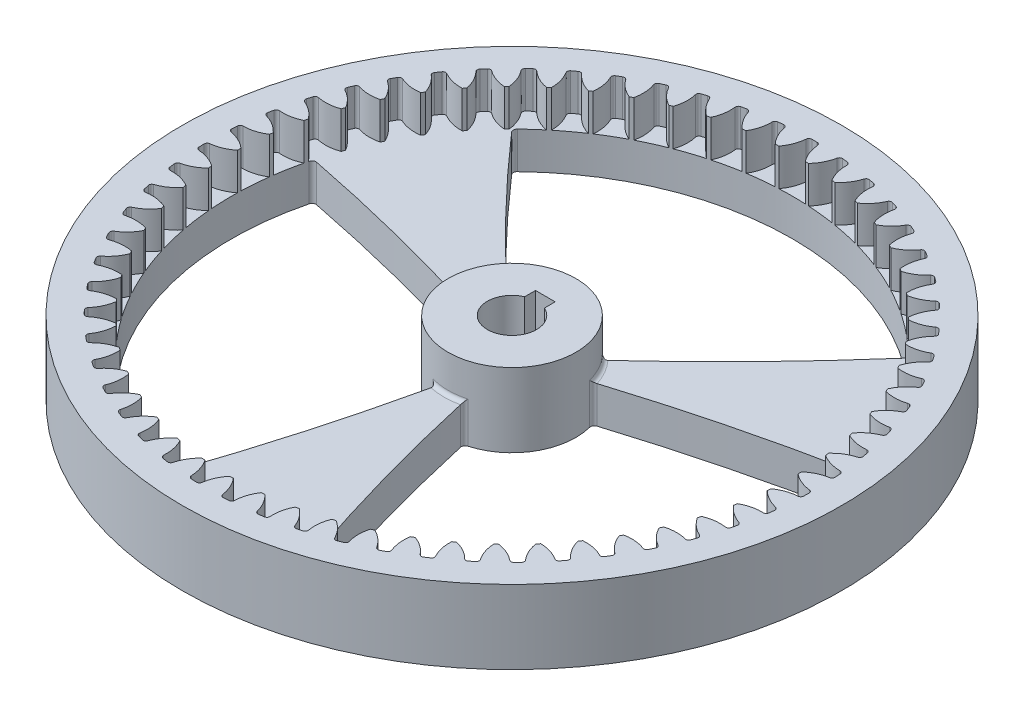
from build123d import *

# Parameters (mm, degrees)
SKETCH1_R                = 67
SKETCH1_R_2              = 61.5
SKETCH1_R_3              = 57
BOSS_EXTRUDE1_DEPTH      = 7.5
CUT_EXTRUDE1_DEPTH       = 96.048671742
FILLET1_R                = 0.6
CIRPATTERN1_COUNT        = 59
FILLET1_OF_CIRPATTERN1_R = 0.6
BOSS_EXTRUDE2_START      = 7.5
SKETCH3_R                = 67
BOSS_EXTRUDE2_DEPTH      = 7.5
SKETCH4_R                = 13
BOSS_EXTRUDE3_DEPTH      = 7.5
CUT_EXTRUDE2_START       = -10
CUT_EXTRUDE2_DEPTH       = 10
FILLET2_R                = 0.8


with BuildPart() as part:
    # Sketch1 → Boss-Extrude1 (new body)
    # profile 1 of 2: a face of its own
    with BuildSketch(Plane(origin=(0, 0, 0), x_dir=(1, 0, 0), z_dir=(0, 1, 0))):
        with Locations(Location((0, 0, 0), (0, 0, 270))):
            Circle(SKETCH1_R)
        Circle(SKETCH1_R_2, mode=Mode.SUBTRACT)
    # profile 2 of 2: a face of its own
    with BuildSketch(Plane(origin=(0, 0, 0), x_dir=(1, 0, 0), z_dir=(0, 1, 0))):
        Circle(SKETCH1_R_2)
        with Locations(Location((0, 0, 0), (0, 0, 270))):
            Circle(SKETCH1_R_3, mode=Mode.SUBTRACT)
    extrude(amount=BOSS_EXTRUDE1_DEPTH)

    # Sketch2 → Cut-Extrude1 (cut, through all)
    with BuildSketch(Plane(origin=(0, 7.5, 0), x_dir=(1, 0, 0), z_dir=(0, 1, 0))):
        with BuildLine():
            ThreePointArc((-2.683664177, 56.936789044), (0, 57), (2.683664177, 56.936789044))
            ThreePointArc((2.683664177, 56.936789044), (1.531877994, 59.088018005), (1.102550575, 61.490116134))
            ThreePointArc((1.102550575, 61.490116134), (0, 61.5), (-1.102550575, 61.490116134))
            ThreePointArc((-1.102550575, 61.490116134), (-1.531877994, 59.088018005), (-2.683664177, 56.936789044))
        make_face()
    cut_extrude1 = extrude(amount=-CUT_EXTRUDE1_DEPTH, mode=Mode.SUBTRACT)

    # Fillet1
    fillet1_edges = [part.edges().sort_by_distance(p)[0] for p in [
        (1.102550575, 3.75, -61.490116134),
        (-1.102550575, 3.75, -61.490116134),
    ]]
    fillet(fillet1_edges, radius=FILLET1_R)

    # CirPattern1: Cut-Extrude1 ×59 about axis
    cirpattern1_axis = Axis((0, 0, 0), (0, 1, 0))
    for i in range(1, CIRPATTERN1_COUNT):
        add(cut_extrude1.rotate(cirpattern1_axis, i * 360 / CIRPATTERN1_COUNT), mode=Mode.SUBTRACT)

    # Fillet1 of CirPattern1
    fillet1_of_cirpattern1_edges = [part.edges().sort_by_distance(p)[0] for p in [
        (-5.439694371, 3.75, -61.258956285),
        (-7.632303183, 3.75, -61.024568398),
        (-11.920305406, 3.75, -60.333707983),
        (-14.075578745, 3.75, -59.867587917),
        (-18.265854618, 3.75, -58.724854662),
        (-20.359372377, 3.75, -58.032283743),
        (-24.404444399, 3.75, -56.450625272),
        (-26.412486184, 3.75, -55.539450606),
        (-30.266522072, 3.75, -53.536787741),
        (-32.166335968, 3.75, -52.417333301),
        (-35.785667957, 3.75, -50.016357013),
        (-37.555728313, 3.75, -48.701306665),
        (-40.899347925, 3.75, -45.929220974),
        (-42.51959925, 3.75, -44.433474764),
        (-45.549621938, 3.75, -41.32168851),
        (-47.001706138, 3.75, -39.662193839),
        (-49.683800534, 3.75, -36.245964803),
        (-50.951264913, 3.75, -34.441524411),
        (-53.255041817, 3.75, -30.759559832),
        (-54.323525499, 3.75, -28.830618748),
        (-56.222882197, 3.75, -24.924636757),
        (-57.080278834, 3.75, -22.893050655),
        (-58.553694856, 3.75, -18.807307588),
        (-59.190289801, 3.75, -16.69609515),
        (-60.221070755, 3.75, -12.476884109),
        (-60.629651134, 3.75, -10.309966216),
        (-61.20611786, 3.75, -6.005092548),
        (-61.382054293, 3.75, -3.807021245),
        (-61.497675193, 3.75, 0.534739111),
        (-61.43897425, 3.75, 2.739058798),
        (-61.092439292, 3.75, 7.068511963),
        (-60.799766079, 3.75, 9.254104211),
        (-59.995001643, 3.75, 13.522195749),
        (-59.471672264, 3.75, 15.664296924),
        (-58.217796652, 3.75, 19.822667655),
        (-57.469740638, 3.75, 21.897006895),
        (-55.780960763, 3.75, 25.898540815),
        (-54.816653888, 3.75, 27.881615028),
        (-52.712104299, 3.75, 31.680973159),
        (-51.542472545, 3.75, 33.550313321),
        (-49.045998631, 3.75, 37.104447419),
        (-47.684294393, 3.75, 38.838873159),
        (-44.824182201, 3.75, 42.107513463),
        (-43.285834131, 3.75, 43.687373045),
        (-40.094489876, 3.75, 46.633484554),
        (-38.396928073, 3.75, 48.040877537),
        (-34.910510959, 3.75, 50.631079631),
        (-33.072969477, 3.75, 51.850059691),
        (-29.330982004, 3.75, 54.055004345),
        (-27.374280922, 3.75, 55.07175995),
        (-23.419121302, 3.75, 56.86646426),
        (-21.365430826, 3.75, 57.669475163),
        (-17.241912598, 3.75, 59.033604413),
        (-15.114501861, 3.75, 59.61377218),
        (-10.869346135, 3.75, 60.531870239),
        (-8.692319551, 3.75, 60.882621337),
        (-4.373625637, 3.75, 61.344285788),
        (-2.171649787, 3.75, 61.461646067),
        (2.171649787, 3.75, 61.461646067),
        (4.373625637, 3.75, 61.344285788),
        (8.692319551, 3.75, 60.882621337),
        (10.869346135, 3.75, 60.531870239),
        (15.114501861, 3.75, 59.61377218),
        (17.241912598, 3.75, 59.033604413),
        (21.365430826, 3.75, 57.669475163),
        (23.419121302, 3.75, 56.86646426),
        (27.374280922, 3.75, 55.07175995),
        (29.330982004, 3.75, 54.055004345),
        (33.072969477, 3.75, 51.850059691),
        (34.910510959, 3.75, 50.631079631),
        (38.396928073, 3.75, 48.040877537),
        (40.094489876, 3.75, 46.633484554),
        (43.285834131, 3.75, 43.687373045),
        (44.824182201, 3.75, 42.107513463),
        (47.684294393, 3.75, 38.838873159),
        (49.045998631, 3.75, 37.104447419),
        (51.542472545, 3.75, 33.550313321),
        (52.712104299, 3.75, 31.680973159),
        (54.816653888, 3.75, 27.881615028),
        (55.780960763, 3.75, 25.898540815),
        (57.469740638, 3.75, 21.897006895),
        (58.217796652, 3.75, 19.822667655),
        (59.471672264, 3.75, 15.664296924),
        (59.995001643, 3.75, 13.522195749),
        (60.799766079, 3.75, 9.254104211),
        (61.092439292, 3.75, 7.068511963),
        (61.43897425, 3.75, 2.739058798),
        (61.497675193, 3.75, 0.534739111),
        (61.382054293, 3.75, -3.807021245),
        (61.20611786, 3.75, -6.005092548),
        (60.629651134, 3.75, -10.309966216),
        (60.221070755, 3.75, -12.476884109),
        (59.190289801, 3.75, -16.69609515),
        (58.553694856, 3.75, -18.807307588),
        (57.080278834, 3.75, -22.893050655),
        (56.222882197, 3.75, -24.924636757),
        (54.323525499, 3.75, -28.830618748),
        (53.255041817, 3.75, -30.759559832),
        (50.951264913, 3.75, -34.441524411),
        (49.683800534, 3.75, -36.245964803),
        (47.001706138, 3.75, -39.662193839),
        (45.549621938, 3.75, -41.32168851),
        (42.51959925, 3.75, -44.433474764),
        (40.899347925, 3.75, -45.929220974),
        (37.555728313, 3.75, -48.701306665),
        (35.785667957, 3.75, -50.016357013),
        (32.166335968, 3.75, -52.417333301),
        (30.266522072, 3.75, -53.536787741),
        (26.412486184, 3.75, -55.539450606),
        (24.404444399, 3.75, -56.450625272),
        (20.359372377, 3.75, -58.032283743),
        (18.265854618, 3.75, -58.724854662),
        (14.075578745, 3.75, -59.867587917),
        (11.920305406, 3.75, -60.333707983),
        (7.632303183, 3.75, -61.024568398),
        (5.439694371, 3.75, -61.258956285),
    ]]
    fillet(fillet1_of_cirpattern1_edges, radius=FILLET1_OF_CIRPATTERN1_R)

    # Sketch3 → Boss-Extrude2 (add)
    with BuildSketch(Plane.XZ.offset(BOSS_EXTRUDE2_START)):
        with Locations(Location((0, 0, 0), (0, 0, 270))):
            Circle(SKETCH3_R)
    extrude(amount=-BOSS_EXTRUDE2_DEPTH)

    # Sketch4 → Boss-Extrude3 (add)
    with BuildSketch(Plane(origin=(0, 0, 0), x_dir=(1, 0, 0), z_dir=(0, 1, 0))):
        with Locations(Location((0, 0, 0), (0, 0, 90))):
            Circle(SKETCH4_R)
        with BuildLine():
            Line((-2, 6.782575695), (2, 6.782575695))
            Line((2, 6.782575695), (2, 4.582575695))
            ThreePointArc((2, 4.582575695), (0, -5), (-2, 4.582575695))
            Line((-2, 4.582575695), (-2, 6.782575695))
        make_face(mode=Mode.SUBTRACT)
    extrude(amount=BOSS_EXTRUDE3_DEPTH)

    # Sketch5 → Cut-Extrude2 (cut)
    with BuildSketch(Plane(origin=(0, 0, 0), x_dir=(1, 0, 0), z_dir=(0, 1, 0)).offset(CUT_EXTRUDE2_START)):
        with BuildLine():
            Line((2, 4.582575695), (2, 6.782575695))
            Line((2, 6.782575695), (-2, 6.782575695))
            Line((-2, 6.782575695), (-2, 4.582575695))
            ThreePointArc((-2, 4.582575695), (0, -5), (2, 4.582575695))
        make_face()
        with BuildLine():
            ThreePointArc((40.305086528, 40.305086528), (0, 57), (-40.305086528, 40.305086528))
            ThreePointArc((-40.305086528, 40.305086528), (-25.390348207, 24.109710972), (-9.584605379, 8.782672699))
            ThreePointArc((-9.584605379, 8.782672699), (0, 13), (9.584605379, 8.782672699))
            ThreePointArc((9.584605379, 8.782672699), (25.390348207, 24.109710972), (40.305086528, 40.305086528))
        make_face()
        with BuildLine():
            ThreePointArc((2.813714981, -12.691848093), (11.258330249, -6.5), (12.39832036, 3.909175394))
            ThreePointArc((12.39832036, 3.909175394), (33.574796283, 9.933831072), (55.057772098, 14.752685571))
            ThreePointArc((55.057772098, 14.752685571), (49.363448016, -28.5), (14.752685571, -55.057772098))
            ThreePointArc((14.752685571, -55.057772098), (8.184448076, -34.043542044), (2.813714981, -12.691848093))
        make_face()
        with BuildLine():
            ThreePointArc((-12.39832036, 3.909175394), (-11.258330249, -6.5), (-2.813714981, -12.691848093))
            ThreePointArc((-2.813714981, -12.691848093), (-8.184448076, -34.043542044), (-14.752685571, -55.057772098))
            ThreePointArc((-14.752685571, -55.057772098), (-49.363448016, -28.5), (-55.057772098, 14.752685571))
            ThreePointArc((-55.057772098, 14.752685571), (-33.574796283, 9.933831072), (-12.39832036, 3.909175394))
        make_face()
    extrude(amount=CUT_EXTRUDE2_DEPTH, mode=Mode.SUBTRACT)

    # Fillet2
    # the kernel refuses this fillet: 0.8 mm, written as the material it adds along each edge
    with BuildSketch(Plane(origin=(0, 0, 0), x_dir=(-0.6250382034450774, 0, -0.7805941610300131), z_dir=(0.7805941610300131, 0, -0.6250382034450774))) as fillet2_piece_1_section:
        with BuildLine():
            CenterArc((13 + FILLET2_R, FILLET2_R), FILLET2_R, 180, 90)
            Line((13, FILLET2_R), (13, 0))
            Line((13, 0), (13 + FILLET2_R, 0))
        make_face()
    fillet2_piece_1 = revolve(axis=Axis((0, 0, 0), (0, 1, 0)), revolution_arc=42.630016921, mode=Mode.PRIVATE)
    fillet2_piece_1 = fillet2_piece_1 - Plane(origin=(-129.55823545, 0.179779289, 367.674602351), x_dir=(0.19121489955224177, 0, -0.9815481965696978), z_dir=(0, -1, 0)) * Cylinder(389.616413395, 56, mode=Mode.PRIVATE)
    fillet2_piece_1 = fillet2_piece_1 - Plane(origin=(253.636428238, 0.179779289, -296.038024345), x_dir=(-0.7544382234920409, 0, 0.656371058879178), z_dir=(0, -1, 0)) * Cylinder(389.616413395, 56, mode=Mode.PRIVATE)
    add(fillet2_piece_1)
    with BuildSketch(Plane(origin=(0, 0, 0), x_dir=(-0.36349527177526053, 0, 0.931596043034227), z_dir=(-0.931596043034227, 0, -0.36349527177526053))) as fillet2_piece_2_section:
        with BuildLine():
            CenterArc((13 + FILLET2_R, FILLET2_R), FILLET2_R, 180, 90)
            Line((13, FILLET2_R), (13, 0))
            Line((13, 0), (13 + FILLET2_R, 0))
        make_face()
    fillet2_piece_2 = revolve(axis=Axis((0, 0, 0), (0, 1, 0)), revolution_arc=42.630016921, mode=Mode.PRIVATE)
    fillet2_piece_2 = fillet2_piece_2 - Plane(origin=(-383.194663688, 0.179779293, -71.636578007), x_dir=(0.9762960071199293, 0, 0.21643961393812167), z_dir=(0, -1, 0)) * Cylinder(389.616413395, 56, mode=Mode.PRIVATE)
    fillet2_piece_2 = fillet2_piece_2 - Plane(origin=(383.194663688, 0.179779293, -71.636578007), x_dir=(-0.9456531230442833, 0, 0.32517713769051104), z_dir=(0, -1, 0)) * Cylinder(389.616413395, 56, mode=Mode.PRIVATE)
    add(fillet2_piece_2)
    with BuildSketch(Plane(origin=(0, 0, 0), x_dir=(0.9885334752203317, 0, -0.15100188200421122), z_dir=(0.15100188200421122, 0, 0.9885334752203317))) as fillet2_piece_3_section:
        with BuildLine():
            CenterArc((13 + FILLET2_R, FILLET2_R), FILLET2_R, 180, 90)
            Line((13, FILLET2_R), (13, 0))
            Line((13, 0), (13 + FILLET2_R, 0))
        make_face()
    fillet2_piece_3 = revolve(axis=Axis((0, 0, 0), (0, 1, 0)), revolution_arc=42.630016921, mode=Mode.PRIVATE)
    fillet2_piece_3 = fillet2_piece_3 - Plane(origin=(-253.636428238, 0.179779297, -296.038024345), x_dir=(0.6755902076156609, 0, 0.7372773368101235), z_dir=(0, -1, 0)) * Cylinder(389.616413395, 56, mode=Mode.PRIVATE)
    fillet2_piece_3 = fillet2_piece_3 - Plane(origin=(129.55823545, 0.179779297, 367.674602351), x_dir=(-0.30070579950426674, 0, -0.953716950748229), z_dir=(0, -1, 0)) * Cylinder(389.616413395, 56, mode=Mode.PRIVATE)
    add(fillet2_piece_3)
    with BuildSketch(Plane(origin=(-9.584605379, -7.5, -8.782672699), x_dir=(-0.7366021480491705, 0, -0.6763263084409388), z_dir=(0, 1, 0)), Plane(origin=(-2.813714981, -7.5, 12.691848093), x_dir=(-0.21741469033294974, 0, 0.9760793269132522), z_dir=(0, 1, 0)), Plane(origin=(12.39832036, -7.5, -3.909175394), x_dir=(0.9540168383821627, 0, -0.29975301847237895), z_dir=(0, 1, 0))) as fillet2_piece_4:
        with BuildLine():
            CenterArc((0.777546481, -0.799999601), FILLET2_R, 89.94276945, 86.787876714)
            ThreePointArc((-0.02115149, -0.754375578), (-0.005100494, -0.377341306), (0, 0))
            ThreePointArc((0, 0), (0.389172785, 0.000194365), (0.77834557, 0))
        make_face()
    extrude(amount=7.5)
    with BuildSketch(Plane(origin=(-40.305086528, -7.5, -40.305086528), x_dir=(0.7117887849670748, 0, -0.7023935688736731), z_dir=(0, 1, 0)), Plane(origin=(-14.752685571, -7.5, 55.057772098), x_dir=(-0.9641850665829556, 0, -0.2652303854735005), z_dir=(0, 1, 0)), Plane(origin=(55.057772098, -7.5, -14.752685571), x_dir=(0.252396281615873, 0, 0.9676239543471837), z_dir=(0, 1, 0))) as fillet2_piece_5:
        with BuildLine():
            CenterArc((0.752035258, -0.799982346), FILLET2_R, 89.619357215, 86.895681343)
            ThreePointArc((-0.046485372, -0.751353102), (-0.02342415, -0.375665324), (0, 0))
            ThreePointArc((0, 0), (0.378674998, 0.001257863), (0.757349995, 0))
        make_face()
    extrude(amount=7.5)
    with BuildSketch(Plane(origin=(40.305086528, -7.5, -40.305086528), x_dir=(-0.7117887849670426, 0, -0.7023935688737057), z_dir=(0, 1, 0)), Plane(origin=(-55.057772098, -7.5, -14.752685571), x_dir=(-0.25239628161590455, 0, 0.9676239543471756), z_dir=(0, 1, 0)), Plane(origin=(14.752685571, -7.5, 55.057772098), x_dir=(0.9641850665829531, 0, -0.2652303854735089), z_dir=(0, 1, 0))) as fillet2_piece_6:
        with BuildLine():
            CenterArc((0.752035258, 0.799982346), FILLET2_R, 183.484961443, 86.895681343)
            ThreePointArc((-0.046485372, 0.751353102), (-0.02342415, 0.375665324), (0, 0))
            ThreePointArc((0, 0), (0.378674998, -0.001257863), (0.757349995, 0))
        make_face()
    extrude(amount=7.5)
    with BuildSketch(Plane(origin=(9.584605379, -7.5, -8.782672699), x_dir=(0.736602148049218, 0, -0.6763263084408871), z_dir=(0, 1, 0)), Plane(origin=(-12.39832036, -7.5, -3.909175394), x_dir=(-0.9540168383821407, 0, -0.29975301847244895), z_dir=(0, 1, 0)), Plane(origin=(2.813714981, -7.5, 12.691848093), x_dir=(0.2174146903328744, 0, 0.9760793269132692), z_dir=(0, 1, 0))) as fillet2_piece_7:
        with BuildLine():
            CenterArc((0.777546481, 0.799999601), FILLET2_R, 183.269353837, 86.787876714)
            ThreePointArc((-0.02115149, 0.754375578), (-0.005100494, 0.377341306), (0, 0))
            ThreePointArc((0, 0), (0.389172785, -0.000194365), (0.77834557, 0))
        make_face()
    extrude(amount=7.5)
    with BuildSketch(Plane(origin=(0, 0, 0), x_dir=(-0.6250382034450774, 0, -0.7805941610300131), z_dir=(0.7805941610300131, 0, -0.6250382034450774))) as fillet2_piece_8a_section:
        with BuildLine():
            CenterArc((13 + FILLET2_R, FILLET2_R), FILLET2_R, 180, 90)
            Line((13, FILLET2_R), (13, 0))
            Line((13, 0), (13 + FILLET2_R, 0))
        make_face()
    fillet2_piece_8a = revolve(axis=Axis((0, 0, 0), (0, 1, 0)), revolution_arc=42.630016921, mode=Mode.PRIVATE)
    fillet2_piece_8a = fillet2_piece_8a & Plane(origin=(253.636428238, 0.179788129, -296.038024345), x_dir=(-0.7544382234920409, 0, 0.656371058879178), z_dir=(0, -1, 0)) * Cylinder(389.616413395, 56, mode=Mode.PRIVATE)
    with BuildSketch(Plane(origin=(-9.584605379, -7.5, -8.782672699), x_dir=(-0.7366021480491705, 0, -0.6763263084409388), z_dir=(0, 1, 0))) as fillet2_piece_8b_section:
        with BuildLine():
            CenterArc((0.777546481, -0.799999601), FILLET2_R, 89.94276945, 86.787876714)
            ThreePointArc((-0.02115149, -0.754375578), (-0.005100494, -0.377341306), (0, 0))
            ThreePointArc((0, 0), (0.389172785, 0.000194365), (0.77834557, 0))
        make_face()
    fillet2_piece_8b = extrude(amount=9.445863925, mode=Mode.PRIVATE)
    fillet2_piece_8b = split(fillet2_piece_8b, bisect_by=Plane(origin=(-9.598581145, 0, -9.026284278), z_dir=(0, 1, 0)), keep=Keep.TOP, mode=Mode.PRIVATE)
    fillet2_piece_8 = fillet2_piece_8a & fillet2_piece_8b
    add(fillet2_piece_8)
    with BuildSketch(Plane(origin=(0, 0, 0), x_dir=(-0.6250382034450774, 0, -0.7805941610300131), z_dir=(0.7805941610300131, 0, -0.6250382034450774))) as fillet2_piece_9a_section:
        with BuildLine():
            CenterArc((13 + FILLET2_R, FILLET2_R), FILLET2_R, 180, 90)
            Line((13, FILLET2_R), (13, 0))
            Line((13, 0), (13 + FILLET2_R, 0))
        make_face()
    fillet2_piece_9a = revolve(axis=Axis((0, 0, 0), (0, 1, 0)), revolution_arc=42.630016921, mode=Mode.PRIVATE)
    fillet2_piece_9a = fillet2_piece_9a & Plane(origin=(-129.55823545, 0.179788131, 367.674602351), x_dir=(0.19121489955224177, 0, -0.9815481965696978), z_dir=(0, -1, 0)) * Cylinder(389.616413395, 56, mode=Mode.PRIVATE)
    with BuildSketch(Plane(origin=(-12.39832036, -7.5, -3.909175394), x_dir=(-0.9540168383821407, 0, -0.29975301847244895), z_dir=(0, 1, 0))) as fillet2_piece_9b_section:
        with BuildLine():
            CenterArc((0.777546481, 0.799999601), FILLET2_R, 183.269353837, 86.787876714)
            ThreePointArc((-0.02115149, 0.754375578), (-0.005100494, 0.377341306), (0, 0))
            ThreePointArc((0, 0), (0.389172785, -0.000194365), (0.77834557, 0))
        make_face()
    fillet2_piece_9b = extrude(amount=9.445863925, mode=Mode.PRIVATE)
    fillet2_piece_9b = split(fillet2_piece_9b, bisect_by=Plane(origin=(-12.616282058, 0, -3.799472973), z_dir=(0, 1, 0)), keep=Keep.TOP, mode=Mode.PRIVATE)
    fillet2_piece_9 = fillet2_piece_9a & fillet2_piece_9b
    add(fillet2_piece_9)
    with BuildSketch(Plane(origin=(0, 0, 0), x_dir=(-0.36349527177526053, 0, 0.931596043034227), z_dir=(-0.931596043034227, 0, -0.36349527177526053))) as fillet2_piece_10a_section:
        with BuildLine():
            CenterArc((13 + FILLET2_R, FILLET2_R), FILLET2_R, 180, 90)
            Line((13, FILLET2_R), (13, 0))
            Line((13, 0), (13 + FILLET2_R, 0))
        make_face()
    fillet2_piece_10a = revolve(axis=Axis((0, 0, 0), (0, 1, 0)), revolution_arc=42.630016921, mode=Mode.PRIVATE)
    fillet2_piece_10a = fillet2_piece_10a & Plane(origin=(-383.194663688, 0.179788133, -71.636578007), x_dir=(0.9762960071199293, 0, 0.21643961393812167), z_dir=(0, -1, 0)) * Cylinder(389.616413395, 56, mode=Mode.PRIVATE)
    with BuildSketch(Plane(origin=(-2.813714981, -7.5, 12.691848093), x_dir=(-0.21741469033294974, 0, 0.9760793269132522), z_dir=(0, 1, 0))) as fillet2_piece_10b_section:
        with BuildLine():
            CenterArc((0.777546481, -0.799999601), FILLET2_R, 89.94276945, 86.787876714)
            ThreePointArc((-0.02115149, -0.754375578), (-0.005100494, -0.377341306), (0, 0))
            ThreePointArc((0, 0), (0.389172785, 0.000194365), (0.77834557, 0))
        make_face()
    fillet2_piece_10b = extrude(amount=9.445863925, mode=Mode.PRIVATE)
    fillet2_piece_10b = split(fillet2_piece_10b, bisect_by=Plane(origin=(-3.017700914, 0, 12.82575725), z_dir=(0, 1, 0)), keep=Keep.TOP, mode=Mode.PRIVATE)
    fillet2_piece_10 = fillet2_piece_10a & fillet2_piece_10b
    add(fillet2_piece_10)
    with BuildSketch(Plane(origin=(0, 0, 0), x_dir=(-0.36349527177526053, 0, 0.931596043034227), z_dir=(-0.931596043034227, 0, -0.36349527177526053))) as fillet2_piece_11a_section:
        with BuildLine():
            CenterArc((13 + FILLET2_R, FILLET2_R), FILLET2_R, 180, 90)
            Line((13, FILLET2_R), (13, 0))
            Line((13, 0), (13 + FILLET2_R, 0))
        make_face()
    fillet2_piece_11a = revolve(axis=Axis((0, 0, 0), (0, 1, 0)), revolution_arc=42.630016921, mode=Mode.PRIVATE)
    fillet2_piece_11a = fillet2_piece_11a & Plane(origin=(383.194663688, 0.179788131, -71.636578007), x_dir=(-0.9456531230442833, 0, 0.32517713769051104), z_dir=(0, -1, 0)) * Cylinder(389.616413395, 56, mode=Mode.PRIVATE)
    with BuildSketch(Plane(origin=(2.813714981, -7.5, 12.691848093), x_dir=(0.2174146903328744, 0, 0.9760793269132692), z_dir=(0, 1, 0))) as fillet2_piece_11b_section:
        with BuildLine():
            CenterArc((0.777546481, 0.799999601), FILLET2_R, 183.269353837, 86.787876714)
            ThreePointArc((-0.02115149, 0.754375578), (-0.005100494, 0.377341306), (0, 0))
            ThreePointArc((0, 0), (0.389172785, -0.000194365), (0.77834557, 0))
        make_face()
    fillet2_piece_11b = extrude(amount=9.445863925, mode=Mode.PRIVATE)
    fillet2_piece_11b = split(fillet2_piece_11b, bisect_by=Plane(origin=(3.017700914, 0, 12.82575725), z_dir=(0, 1, 0)), keep=Keep.TOP, mode=Mode.PRIVATE)
    fillet2_piece_11 = fillet2_piece_11a & fillet2_piece_11b
    add(fillet2_piece_11)
    with BuildSketch(Plane(origin=(0, 0, 0), x_dir=(0.9885334752203317, 0, -0.15100188200421122), z_dir=(0.15100188200421122, 0, 0.9885334752203317))) as fillet2_piece_12a_section:
        with BuildLine():
            CenterArc((13 + FILLET2_R, FILLET2_R), FILLET2_R, 180, 90)
            Line((13, FILLET2_R), (13, 0))
            Line((13, 0), (13 + FILLET2_R, 0))
        make_face()
    fillet2_piece_12a = revolve(axis=Axis((0, 0, 0), (0, 1, 0)), revolution_arc=42.630016921, mode=Mode.PRIVATE)
    fillet2_piece_12a = fillet2_piece_12a & Plane(origin=(129.55823545, 0.179788133, 367.674602351), x_dir=(-0.30070579950426674, 0, -0.953716950748229), z_dir=(0, -1, 0)) * Cylinder(389.616413395, 56, mode=Mode.PRIVATE)
    with BuildSketch(Plane(origin=(12.39832036, -7.5, -3.909175394), x_dir=(0.9540168383821627, 0, -0.29975301847237895), z_dir=(0, 1, 0))) as fillet2_piece_12b_section:
        with BuildLine():
            CenterArc((0.777546481, -0.799999601), FILLET2_R, 89.94276945, 86.787876714)
            ThreePointArc((-0.02115149, -0.754375578), (-0.005100494, -0.377341306), (0, 0))
            ThreePointArc((0, 0), (0.389172785, 0.000194365), (0.77834557, 0))
        make_face()
    fillet2_piece_12b = extrude(amount=9.445863925, mode=Mode.PRIVATE)
    fillet2_piece_12b = split(fillet2_piece_12b, bisect_by=Plane(origin=(12.616282058, 0, -3.799472973), z_dir=(0, 1, 0)), keep=Keep.TOP, mode=Mode.PRIVATE)
    fillet2_piece_12 = fillet2_piece_12a & fillet2_piece_12b
    add(fillet2_piece_12)
    with BuildSketch(Plane(origin=(0, 0, 0), x_dir=(0.9885334752203317, 0, -0.15100188200421122), z_dir=(0.15100188200421122, 0, 0.9885334752203317))) as fillet2_piece_13a_section:
        with BuildLine():
            CenterArc((13 + FILLET2_R, FILLET2_R), FILLET2_R, 180, 90)
            Line((13, FILLET2_R), (13, 0))
            Line((13, 0), (13 + FILLET2_R, 0))
        make_face()
    fillet2_piece_13a = revolve(axis=Axis((0, 0, 0), (0, 1, 0)), revolution_arc=42.630016921, mode=Mode.PRIVATE)
    fillet2_piece_13a = fillet2_piece_13a & Plane(origin=(-253.636428238, 0.179788135, -296.038024345), x_dir=(0.6755902076156609, 0, 0.7372773368101235), z_dir=(0, -1, 0)) * Cylinder(389.616413395, 56, mode=Mode.PRIVATE)
    with BuildSketch(Plane(origin=(9.584605379, -7.5, -8.782672699), x_dir=(0.736602148049218, 0, -0.6763263084408871), z_dir=(0, 1, 0))) as fillet2_piece_13b_section:
        with BuildLine():
            CenterArc((0.777546481, 0.799999601), FILLET2_R, 183.269353837, 86.787876714)
            ThreePointArc((-0.02115149, 0.754375578), (-0.005100494, 0.377341306), (0, 0))
            ThreePointArc((0, 0), (0.389172785, -0.000194365), (0.77834557, 0))
        make_face()
    fillet2_piece_13b = extrude(amount=9.445863925, mode=Mode.PRIVATE)
    fillet2_piece_13b = split(fillet2_piece_13b, bisect_by=Plane(origin=(9.598581145, 0, -9.026284278), z_dir=(0, 1, 0)), keep=Keep.TOP, mode=Mode.PRIVATE)
    fillet2_piece_13 = fillet2_piece_13a & fillet2_piece_13b
    add(fillet2_piece_13)


solid = part.part
